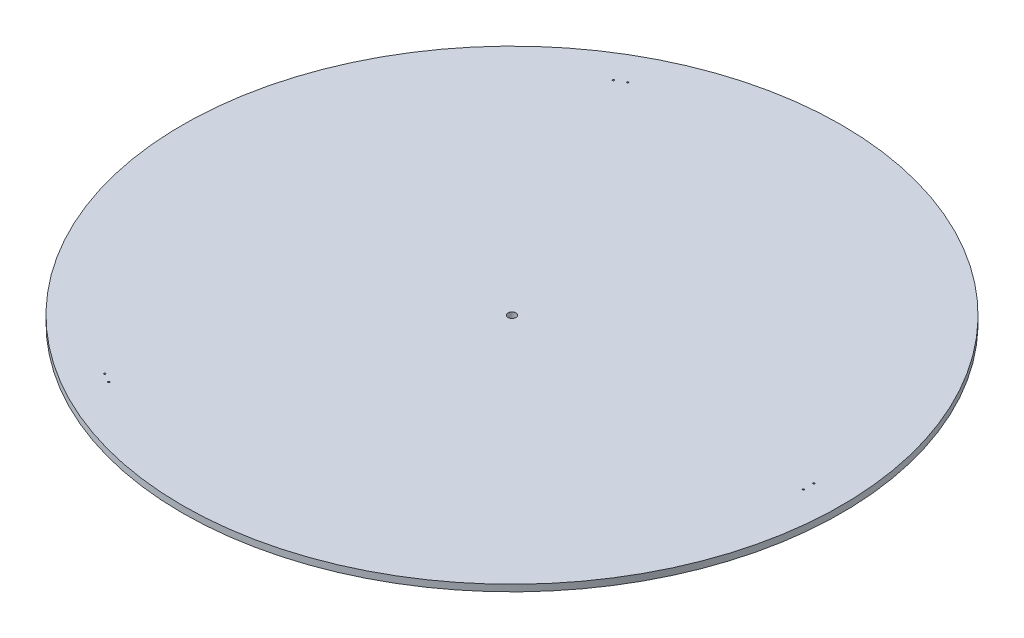
from build123d import *

# Parameters (mm, degrees)
ESQUISSE1_R                  = 500
BOSS_EXTRU_1_DEPTH           = 5
D_GAGEMENT_M101_D            = 12
D_GAGEMENT_M101_CSINK_D      = 12.05
D_GAGEMENT_M101_CSINK_ANGLE  = 90
ESQUISSE6_R                  = 1.25
ENL_V_MAT_EXTRU_1_DEPTH      = 708.177488329
R_P_TITION_CIRCULAIRE1_COUNT = 3


with BuildPart() as part:
    # Esquisse1 → Boss.-Extru.1 (new, symmetric)
    with BuildSketch(Plane(origin=(0, 0, 0), x_dir=(1, 0, 0), z_dir=(0, 1, 0))):
        Circle(ESQUISSE1_R)
    extrude(amount=BOSS_EXTRU_1_DEPTH, both=True)

    # Dégagement M101 (through all)
    with Locations(Plane(origin=(0, 5, 0), x_dir=(1, 0, 0), z_dir=(0, 1, 0))):
        with Locations((0, 0)):
            CounterSinkHole(D_GAGEMENT_M101_D / 2, D_GAGEMENT_M101_CSINK_D / 2, counter_sink_angle=D_GAGEMENT_M101_CSINK_ANGLE)

    # Esquisse6 → Enlèv. mat.-Extru.1 (cut, through all)
    with BuildSketch(Plane(origin=(0, 5, 0), x_dir=(1, 0, 0), z_dir=(0, 1, 0))):
        with Locations((450, 8)):
            Circle(ESQUISSE6_R)
        with Locations((450, -8)):
            Circle(ESQUISSE6_R)
    enl_v_mat_extru_1 = extrude(amount=-ENL_V_MAT_EXTRU_1_DEPTH, mode=Mode.SUBTRACT)

    # Répétition circulaire1: Enlèv. mat.-Extru.1 ×3 about axis
    r_p_tition_circulaire1_axis = Axis((0, 5, 0), (0, 1, 0))
    for i in range(1, R_P_TITION_CIRCULAIRE1_COUNT):
        add(enl_v_mat_extru_1.rotate(r_p_tition_circulaire1_axis, i * 360 / R_P_TITION_CIRCULAIRE1_COUNT), mode=Mode.SUBTRACT)


solid = part.part
